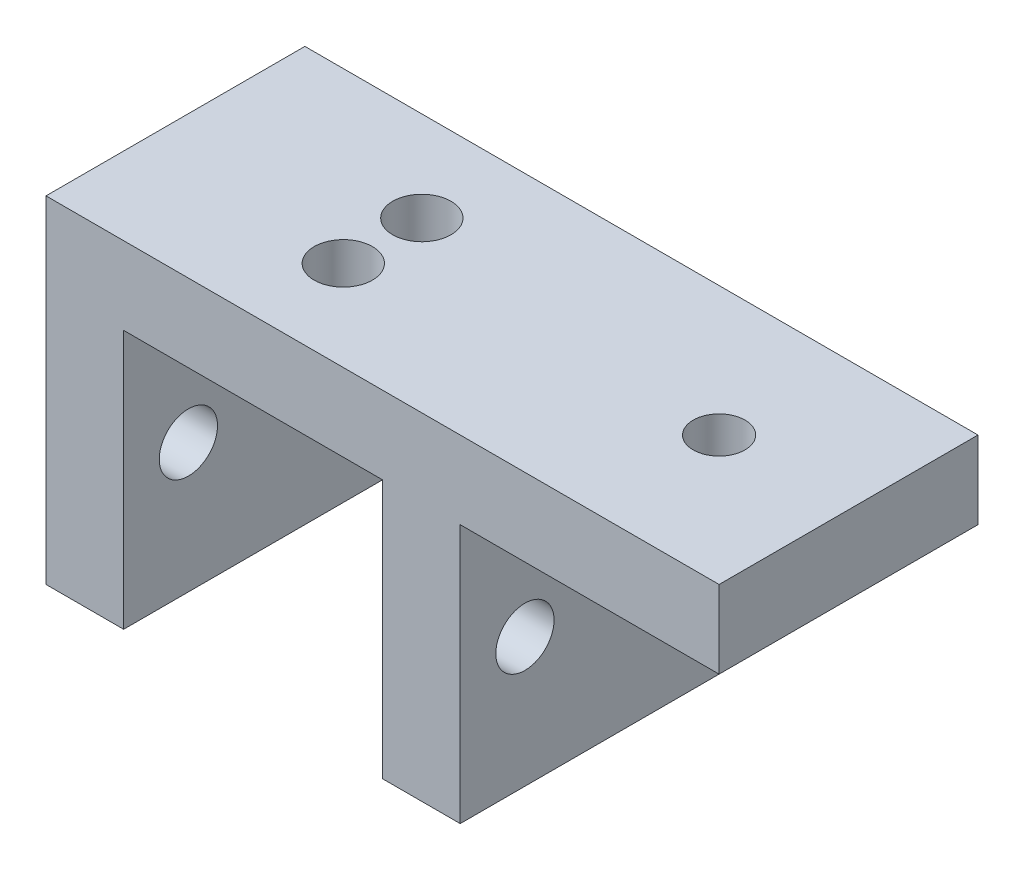
from build123d import *

# Parameters (mm, degrees)
BOSS_EXTRUDE3_DEPTH     = 20
CUT_EXTRUDE1_DEPTH      = 57.497787567
CUT_EXTRUDE1_DEPTH_BACK = 57.497787567
SKETCH9_R               = 2.25
CUT_EXTRUDE2_DEPTH      = 60.194594348
CUT_EXTRUDE2_DEPTH_BACK = 60.194594348
SKETCH10_R              = 2.25
CUT_EXTRUDE3_DEPTH      = 60.194594348
CUT_EXTRUDE3_DEPTH_BACK = 60.194594348
SKETCH11_R              = 2


with BuildPart() as part:
    # Sketch7 → Boss-Extrude3 (new body)
    with BuildSketch(Plane.XY):
        Polygon((-52, -26), (-52, 0), (0, 0), (0, -6), (-20, -6), (-20, -26), (-26, -26), (-26, -6), (-46, -6), (-46, -26), align=None)
    extrude(amount=BOSS_EXTRUDE3_DEPTH)

    # Sketch9 → Cut-Extrude1 (cut, two sides: drawn at the far end of the back side and taken through both)
    with BuildSketch(Plane(origin=(-46, 0, 0), x_dir=(0, 0, -1), z_dir=(1, 0, 0)).offset(-CUT_EXTRUDE1_DEPTH_BACK)):
        with Locations((-15, -16)):
            Circle(SKETCH9_R)
        with Locations((-5, -16)):
            Circle(SKETCH9_R)
    extrude(amount=CUT_EXTRUDE1_DEPTH + CUT_EXTRUDE1_DEPTH_BACK, mode=Mode.SUBTRACT)

    # Sketch10 → Cut-Extrude2 (cut, two sides: drawn at the far end of the back side and taken through both)
    with BuildSketch(Plane.XZ.offset(6).offset(-CUT_EXTRUDE2_DEPTH_BACK)):
        with Locations((-36, 6.966229865)):
            Circle(SKETCH10_R)
        with Locations((-36, 13.033770135)):
            Circle(SKETCH10_R)
    extrude(amount=CUT_EXTRUDE2_DEPTH + CUT_EXTRUDE2_DEPTH_BACK, mode=Mode.SUBTRACT)

    # Sketch11 → Cut-Extrude3 (cut, two sides: drawn at the far end of the back side and taken through both)
    with BuildSketch(Plane.XZ.offset(6).offset(-CUT_EXTRUDE3_DEPTH_BACK)):
        with Locations((-10, 10)):
            Circle(SKETCH11_R)
    extrude(amount=CUT_EXTRUDE3_DEPTH + CUT_EXTRUDE3_DEPTH_BACK, mode=Mode.SUBTRACT)


solid = part.part
